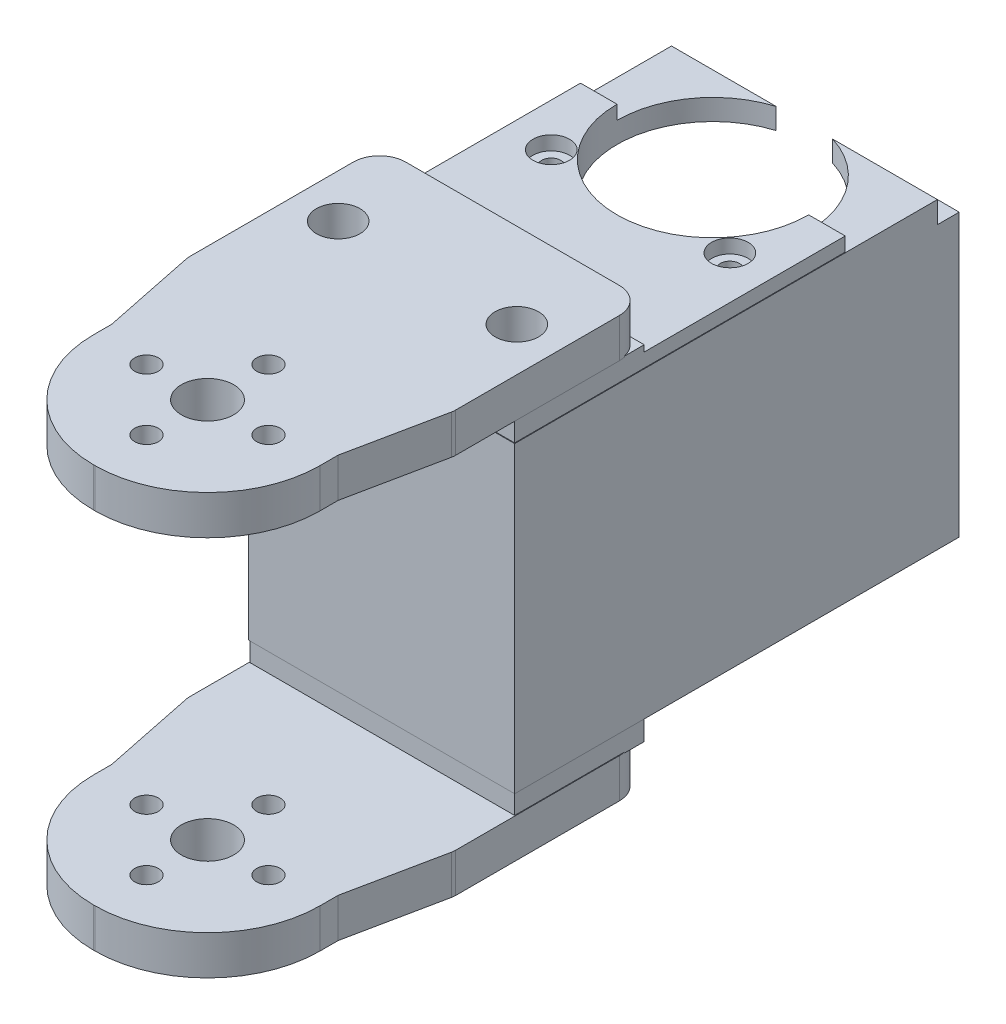
from build123d import *

# Parameters (mm, degrees)
BOSS_1_DEPTH    = 4.5
S_CYL2_R        = 9
BOSS_2_DEPTH    = 2
BOSS_3_DEPTH    = 4.5
S_BOX4_W        = 30.52
S_BOX4_H        = 34.8
BOSS_4_DEPTH    = 2.5
S_BOX5_W        = 2.5
S_BOX5_H        = 34.8
BOSS_5_DEPTH    = 51.02
S_BOX6_W        = 30.52
S_BOX6_H        = 2.4
BOSS_6_DEPTH    = 51.02
S_BOX7_W        = 2.5
S_BOX7_H        = 34.8
BOSS_7_DEPTH    = 18.01
S_BOX8_W        = 30.38
S_BOX8_H        = 2.675
BOSS_8_DEPTH    = 14.87
S_BOX9_W        = 30.38
S_BOX9_H        = 2.425
BOSS_9_DEPTH    = 14.87
S_BOX10_W       = 30.38
S_BOX10_H       = 1.65
BOSS_10_DEPTH   = 37.94
S_HOLE11_R      = 3
HOLE_11_DEPTH   = 4.7
S_HOLE12_R      = 1.35
HOLE_12_DEPTH   = 4.7
S_HOLE13_R      = 1.35
HOLE_13_DEPTH   = 4.7
S_HOLE14_R      = 1.35
HOLE_14_DEPTH   = 4.7
S_HOLE15_R      = 1.35
HOLE_15_DEPTH   = 4.7
S_HOLE16_R      = 3
HOLE_16_DEPTH   = 6.7
S_HOLE17_R      = 1.35
HOLE_17_DEPTH   = 6.7
S_HOLE18_R      = 1.35
HOLE_18_DEPTH   = 6.7
S_HOLE19_R      = 1.35
HOLE_19_DEPTH   = 6.7
S_HOLE20_R      = 1.35
HOLE_20_DEPTH   = 6.7
S_HOLE21_R      = 11
HOLE_21_DEPTH   = 2.6
S_HOLE22_R      = 1.1
HOLE_22_DEPTH   = 2.6
S_HOLE23_R      = 1.1
HOLE_23_DEPTH   = 2.6
S_HOLE24_R      = 1.1
HOLE_24_DEPTH   = 2.6
S_HOLE25_R      = 1.1
HOLE_25_DEPTH   = 2.6
S_CUT26_W       = 30.72
S_CUT26_H       = 2.6
POCKET_26_DEPTH = 2.6
S_HOLE27_R      = 2.5
HOLE_27_DEPTH   = 5.175
S_HOLE28_R      = 2.5
HOLE_28_DEPTH   = 5.175
S_HOLE29_R      = 11
HOLE_29_DEPTH   = 1.8
S_HOLE30_R      = 1.1
HOLE_30_DEPTH   = 1.8
S_HOLE31_R      = 2.1
HOLE_31_DEPTH   = 1.7
S_HOLE32_R      = 1.1
HOLE_32_DEPTH   = 1.8
S_HOLE33_R      = 2.1
HOLE_33_DEPTH   = 1.7
S_HOLE34_R      = 1.1
HOLE_34_DEPTH   = 1.8
S_HOLE35_R      = 2.1
HOLE_35_DEPTH   = 1.7
S_HOLE36_R      = 1.1
HOLE_36_DEPTH   = 1.8
S_HOLE37_R      = 2.1
HOLE_37_DEPTH   = 1.7


with BuildPart() as part:
    # S_prism1 → Boss_1 (new body)
    with BuildSketch(Plane(origin=(0, -23.125, 0), x_dir=(1, 0, 0), z_dir=(0, 1, 0))):
        with BuildLine():
            Line((-13, 2), (-15.2191, 12.8008))
            ThreePointArc((-15.2191, 12.8008), (-15.249701872, 13.001018419), (-15.26, 13.2033))
            Line((-15.26, 13.2033), (-15.26, 32))
            ThreePointArc((-15.26, 32), (-14.3813, 34.1213), (-12.26, 35))
            Line((-12.26, 35), (12.26, 35))
            ThreePointArc((12.26, 35), (14.3813, 34.1213), (15.26, 32))
            Line((15.26, 32), (15.26, 13.2033))
            ThreePointArc((15.26, 13.2033), (15.249701872, 13.001018419), (15.2191, 12.8008))
            Line((15.2191, 12.8008), (13, 2))
            Line((13, 2), (13, -0.1))
            ThreePointArc((13, -0.1), (9.2217, -9.2217), (0.1, -13))
            Line((0.1, -13), (-0.1, -13))
            ThreePointArc((-0.1, -13), (-9.2217, -9.2217), (-13, -0.1))
            Line((-13, -0.1), (-13, 2))
        make_face()
    extrude(amount=BOSS_1_DEPTH)



with BuildPart() as body_2:
    # S_cyl2 → Boss_2 (new body)
    with BuildSketch(Plane(origin=(0, 18.625, 0), x_dir=(1, 0, 0), z_dir=(0, 1, 0))):
        Circle(S_CYL2_R)
    extrude(amount=BOSS_2_DEPTH)

    # S_prism3 → Boss_3 (add)
    with BuildSketch(Plane(origin=(0, 20.625, 0), x_dir=(1, 0, 0), z_dir=(0, 1, 0))):
        with BuildLine():
            Line((-13, 2), (-15.2191, 12.8008))
            ThreePointArc((-15.2191, 12.8008), (-15.249701872, 13.001018419), (-15.26, 13.2033))
            Line((-15.26, 13.2033), (-15.26, 32))
            ThreePointArc((-15.26, 32), (-14.3813, 34.1213), (-12.26, 35))
            Line((-12.26, 35), (12.26, 35))
            ThreePointArc((12.26, 35), (14.3813, 34.1213), (15.26, 32))
            Line((15.26, 32), (15.26, 13.2033))
            ThreePointArc((15.26, 13.2033), (15.249701872, 13.001018419), (15.2191, 12.8008))
            Line((15.2191, 12.8008), (13, 2))
            Line((13, 2), (13, -0.1))
            ThreePointArc((13, -0.1), (9.2217, -9.2217), (0.1, -13))
            Line((0.1, -13), (-0.1, -13))
            ThreePointArc((-0.1, -13), (-9.2217, -9.2217), (-13, -0.1))
            Line((-13, -0.1), (-13, 2))
        make_face()
    extrude(amount=BOSS_3_DEPTH)


with BuildPart() as body_3:
    # S_box4 → Boss_4 (new body)
    with BuildSketch(Plane.XY.offset(-22.49)):
        with Locations((0, 1)):
            Rectangle(S_BOX4_W, S_BOX4_H)
    extrude(amount=BOSS_4_DEPTH)

    # S_box5 → Boss_5 (add)
    with BuildSketch(Plane.XY.offset(-71.01)):
        with Locations((14.01, 1)):
            Rectangle(S_BOX5_W, S_BOX5_H)
    extrude(amount=BOSS_5_DEPTH)

    # S_box6 → Boss_6 (add)
    with BuildSketch(Plane.XY.offset(-71.01)):
        with Locations((0, 17.2)):
            Rectangle(S_BOX6_W, S_BOX6_H)
    extrude(amount=BOSS_6_DEPTH)

    # S_box7 → Boss_7 (add)
    with BuildSketch(Plane.XY.offset(-38)):
        with Locations((-14.01, 1)):
            Rectangle(S_BOX7_W, S_BOX7_H)
    extrude(amount=BOSS_7_DEPTH)


with BuildPart() as part_1:
    add(part.part)

    add(body_3.part)  # Boss_8 merges body 3
    # S_box8 → Boss_8 (add)
    with BuildSketch(Plane.XY.offset(-34.93)):
        with Locations((0, -17.3875)):
            Rectangle(S_BOX8_W, S_BOX8_H)
    extrude(amount=BOSS_8_DEPTH)


    add(body_2.part)  # Boss_9 merges body 2
    # S_box9 → Boss_9 (add)
    with BuildSketch(Plane.XY.offset(-34.93)):
        with Locations((0, 19.5125)):
            Rectangle(S_BOX9_W, S_BOX9_H)
    extrude(amount=BOSS_9_DEPTH)

    # S_box10 → Boss_10 (add)
    with BuildSketch(Plane.XY.offset(-58)):
        with Locations((0, 19.175)):
            Rectangle(S_BOX10_W, S_BOX10_H)
    extrude(amount=BOSS_10_DEPTH)

    # S_hole11 → Hole_11 (cut)
    with BuildSketch(Plane(origin=(0, -23.225, 0), x_dir=(1, 0, 0), z_dir=(0, 1, 0))):
        Circle(S_HOLE11_R)
    extrude(amount=HOLE_11_DEPTH, mode=Mode.SUBTRACT)

    # S_hole12 → Hole_12 (cut)
    with BuildSketch(Plane(origin=(0, -23.225, 0), x_dir=(1, 0, 0), z_dir=(0, 1, 0))):
        with Locations((7, 0)):
            Circle(S_HOLE12_R)
    extrude(amount=HOLE_12_DEPTH, mode=Mode.SUBTRACT)

    # S_hole13 → Hole_13 (cut)
    with BuildSketch(Plane(origin=(0, -23.225, 0), x_dir=(1, 0, 0), z_dir=(0, 1, 0))):
        with Locations((0, -7)):
            Circle(S_HOLE13_R)
    extrude(amount=HOLE_13_DEPTH, mode=Mode.SUBTRACT)

    # S_hole14 → Hole_14 (cut)
    with BuildSketch(Plane(origin=(0, -23.225, 0), x_dir=(1, 0, 0), z_dir=(0, 1, 0))):
        with Locations((-7, 0)):
            Circle(S_HOLE14_R)
    extrude(amount=HOLE_14_DEPTH, mode=Mode.SUBTRACT)

    # S_hole15 → Hole_15 (cut)
    with BuildSketch(Plane(origin=(0, -23.225, 0), x_dir=(1, 0, 0), z_dir=(0, 1, 0))):
        with Locations((0, 7)):
            Circle(S_HOLE15_R)
    extrude(amount=HOLE_15_DEPTH, mode=Mode.SUBTRACT)

    # S_hole16 → Hole_16 (cut)
    with BuildSketch(Plane(origin=(0, 18.525, 0), x_dir=(1, 0, 0), z_dir=(0, 1, 0))):
        Circle(S_HOLE16_R)
    extrude(amount=HOLE_16_DEPTH, mode=Mode.SUBTRACT)

    # S_hole17 → Hole_17 (cut)
    with BuildSketch(Plane(origin=(0, 18.525, 0), x_dir=(1, 0, 0), z_dir=(0, 1, 0))):
        with Locations((7, 0)):
            Circle(S_HOLE17_R)
    extrude(amount=HOLE_17_DEPTH, mode=Mode.SUBTRACT)

    # S_hole18 → Hole_18 (cut)
    with BuildSketch(Plane(origin=(0, 18.525, 0), x_dir=(1, 0, 0), z_dir=(0, 1, 0))):
        with Locations((0, -7)):
            Circle(S_HOLE18_R)
    extrude(amount=HOLE_18_DEPTH, mode=Mode.SUBTRACT)

    # S_hole19 → Hole_19 (cut)
    with BuildSketch(Plane(origin=(0, 18.525, 0), x_dir=(1, 0, 0), z_dir=(0, 1, 0))):
        with Locations((-7, 0)):
            Circle(S_HOLE19_R)
    extrude(amount=HOLE_19_DEPTH, mode=Mode.SUBTRACT)

    # S_hole20 → Hole_20 (cut)
    with BuildSketch(Plane(origin=(0, 18.525, 0), x_dir=(1, 0, 0), z_dir=(0, 1, 0))):
        with Locations((0, 7)):
            Circle(S_HOLE20_R)
    extrude(amount=HOLE_20_DEPTH, mode=Mode.SUBTRACT)

    # S_hole21 → Hole_21 (cut)
    with BuildSketch(Plane(origin=(0, 15.9, 0), x_dir=(1, 0, 0), z_dir=(0, 1, 0))):
        with Locations((0, 58)):
            Circle(S_HOLE21_R)
    extrude(amount=HOLE_21_DEPTH, mode=Mode.SUBTRACT)

    # S_hole22 → Hole_22 (cut)
    with BuildSketch(Plane(origin=(0, 15.9, 0), x_dir=(1, 0, 0), z_dir=(0, 1, 0))):
        with Locations((-10.25, 49.7)):
            Circle(S_HOLE22_R)
    extrude(amount=HOLE_22_DEPTH, mode=Mode.SUBTRACT)

    # S_hole23 → Hole_23 (cut)
    with BuildSketch(Plane(origin=(0, 15.9, 0), x_dir=(1, 0, 0), z_dir=(0, 1, 0))):
        with Locations((10.25, 49.7)):
            Circle(S_HOLE23_R)
    extrude(amount=HOLE_23_DEPTH, mode=Mode.SUBTRACT)

    # S_hole24 → Hole_24 (cut)
    with BuildSketch(Plane(origin=(0, 15.9, 0), x_dir=(1, 0, 0), z_dir=(0, 1, 0))):
        with Locations((-10.25, 25.25)):
            Circle(S_HOLE24_R)
    extrude(amount=HOLE_24_DEPTH, mode=Mode.SUBTRACT)

    # S_hole25 → Hole_25 (cut)
    with BuildSketch(Plane(origin=(0, 15.9, 0), x_dir=(1, 0, 0), z_dir=(0, 1, 0))):
        with Locations((10.25, 25.25)):
            Circle(S_HOLE25_R)
    extrude(amount=HOLE_25_DEPTH, mode=Mode.SUBTRACT)

    # S_cut26 → Pocket_26 (cut)
    with BuildSketch(Plane.XY.offset(-71.11)):
        with Locations((0, 17.2)):
            Rectangle(S_CUT26_W, S_CUT26_H)
    extrude(amount=POCKET_26_DEPTH, mode=Mode.SUBTRACT)

    # S_hole27 → Hole_27 (cut)
    with BuildSketch(Plane(origin=(0, 20.05, 0), x_dir=(1, 0, 0), z_dir=(0, 1, 0))):
        with Locations((-10.25, 25.25)):
            Circle(S_HOLE27_R)
    extrude(amount=HOLE_27_DEPTH, mode=Mode.SUBTRACT)

    # S_hole28 → Hole_28 (cut)
    with BuildSketch(Plane(origin=(0, 20.05, 0), x_dir=(1, 0, 0), z_dir=(0, 1, 0))):
        with Locations((10.25, 25.25)):
            Circle(S_HOLE28_R)
    extrude(amount=HOLE_28_DEPTH, mode=Mode.SUBTRACT)

    # S_hole29 → Hole_29 (cut)
    with BuildSketch(Plane(origin=(0, 18.3, 0), x_dir=(1, 0, 0), z_dir=(0, 1, 0))):
        with Locations((0, 58)):
            Circle(S_HOLE29_R)
    extrude(amount=HOLE_29_DEPTH, mode=Mode.SUBTRACT)

    # S_hole30 → Hole_30 (cut)
    with BuildSketch(Plane(origin=(0, 18.3, 0), x_dir=(1, 0, 0), z_dir=(0, 1, 0))):
        with Locations((-10.25, 49.7)):
            Circle(S_HOLE30_R)
    extrude(amount=HOLE_30_DEPTH, mode=Mode.SUBTRACT)

    # S_hole31 → Hole_31 (cut)
    with BuildSketch(Plane(origin=(0, 18.4, 0), x_dir=(1, 0, 0), z_dir=(0, 1, 0))):
        with Locations((-10.25, 49.7)):
            Circle(S_HOLE31_R)
    extrude(amount=HOLE_31_DEPTH, mode=Mode.SUBTRACT)

    # S_hole32 → Hole_32 (cut)
    with BuildSketch(Plane(origin=(0, 18.3, 0), x_dir=(1, 0, 0), z_dir=(0, 1, 0))):
        with Locations((10.25, 49.7)):
            Circle(S_HOLE32_R)
    extrude(amount=HOLE_32_DEPTH, mode=Mode.SUBTRACT)

    # S_hole33 → Hole_33 (cut)
    with BuildSketch(Plane(origin=(0, 18.4, 0), x_dir=(1, 0, 0), z_dir=(0, 1, 0))):
        with Locations((10.25, 49.7)):
            Circle(S_HOLE33_R)
    extrude(amount=HOLE_33_DEPTH, mode=Mode.SUBTRACT)

    # S_hole34 → Hole_34 (cut)
    with BuildSketch(Plane(origin=(0, 18.3, 0), x_dir=(1, 0, 0), z_dir=(0, 1, 0))):
        with Locations((-10.25, 25.25)):
            Circle(S_HOLE34_R)
    extrude(amount=HOLE_34_DEPTH, mode=Mode.SUBTRACT)

    # S_hole35 → Hole_35 (cut)
    with BuildSketch(Plane(origin=(0, 18.4, 0), x_dir=(1, 0, 0), z_dir=(0, 1, 0))):
        with Locations((-10.25, 25.25)):
            Circle(S_HOLE35_R)
    extrude(amount=HOLE_35_DEPTH, mode=Mode.SUBTRACT)

    # S_hole36 → Hole_36 (cut)
    with BuildSketch(Plane(origin=(0, 18.3, 0), x_dir=(1, 0, 0), z_dir=(0, 1, 0))):
        with Locations((10.25, 25.25)):
            Circle(S_HOLE36_R)
    extrude(amount=HOLE_36_DEPTH, mode=Mode.SUBTRACT)

    # S_hole37 → Hole_37 (cut)
    with BuildSketch(Plane(origin=(0, 18.4, 0), x_dir=(1, 0, 0), z_dir=(0, 1, 0))):
        with Locations((10.25, 25.25)):
            Circle(S_HOLE37_R)
    extrude(amount=HOLE_37_DEPTH, mode=Mode.SUBTRACT)


solid = part_1.part
